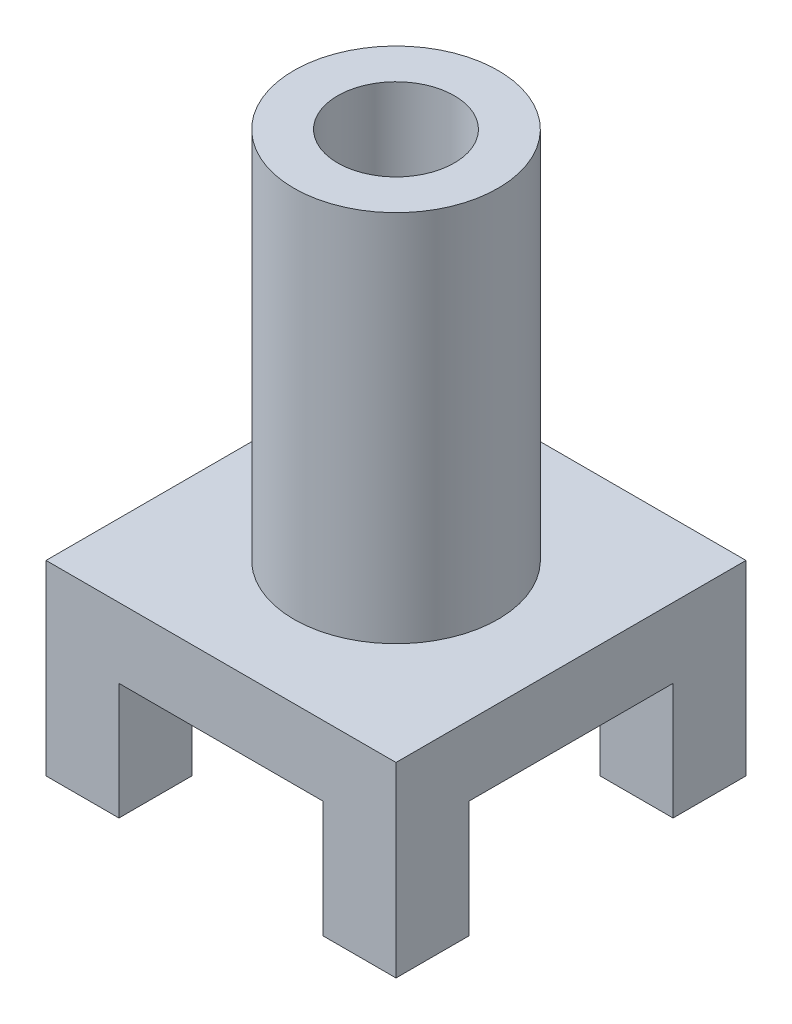
from build123d import *

# Parameters (mm, degrees)
CROQUIS1_W              = 60
CROQUIS1_H              = 60
SALIENTE_EXTRUIR2_DEPTH = 32
CROQUIS2_W              = 35
CROQUIS2_H              = 20
CORTAR_EXTRUIR1_DEPTH   = 75.323616704
CROQUIS4_W              = 35
CROQUIS4_H              = 20
CORTAR_EXTRUIR3_DEPTH   = 75.323616704
CROQUIS5_R              = 17.5
SALIENTE_EXTRUIR3_DEPTH = 64
CROQUIS6_R              = 10
CORTAR_EXTRUIR5_DEPTH   = 105.957134107


with BuildPart() as part:
    # Croquis1 → Saliente-Extruir2 (new body)
    with BuildSketch(Plane(origin=(0, 0, 0), x_dir=(1, 0, 0), z_dir=(0, 1, 0))):
        Rectangle(CROQUIS1_W, CROQUIS1_H)
    extrude(amount=SALIENTE_EXTRUIR2_DEPTH)

    # Croquis2 → Cortar-Extruir1 (cut, through all)
    with BuildSketch(Plane(origin=(30, 0, 0), x_dir=(0, 0, -1), z_dir=(1, 0, 0))):
        with Locations((0, 10)):
            Rectangle(CROQUIS2_W, CROQUIS2_H)
    extrude(amount=-CORTAR_EXTRUIR1_DEPTH, mode=Mode.SUBTRACT)

    # Croquis4 → Cortar-Extruir3 (cut, through all)
    with BuildSketch(Plane.XY.offset(30)):
        with Locations((0, 10)):
            Rectangle(CROQUIS4_W, CROQUIS4_H)
    extrude(amount=-CORTAR_EXTRUIR3_DEPTH, mode=Mode.SUBTRACT)

    # Croquis5 → Saliente-Extruir3 (add)
    with BuildSketch(Plane(origin=(0, 32, 0), x_dir=(1, 0, 0), z_dir=(0, 1, 0))):
        Circle(CROQUIS5_R)
    extrude(amount=SALIENTE_EXTRUIR3_DEPTH)

    # Croquis6 → Cortar-Extruir5 (cut, through all)
    with BuildSketch(Plane(origin=(0, 96, 0), x_dir=(1, 0, 0), z_dir=(0, 1, 0))):
        Circle(CROQUIS6_R)
    extrude(amount=-CORTAR_EXTRUIR5_DEPTH, mode=Mode.SUBTRACT)


solid = part.part
